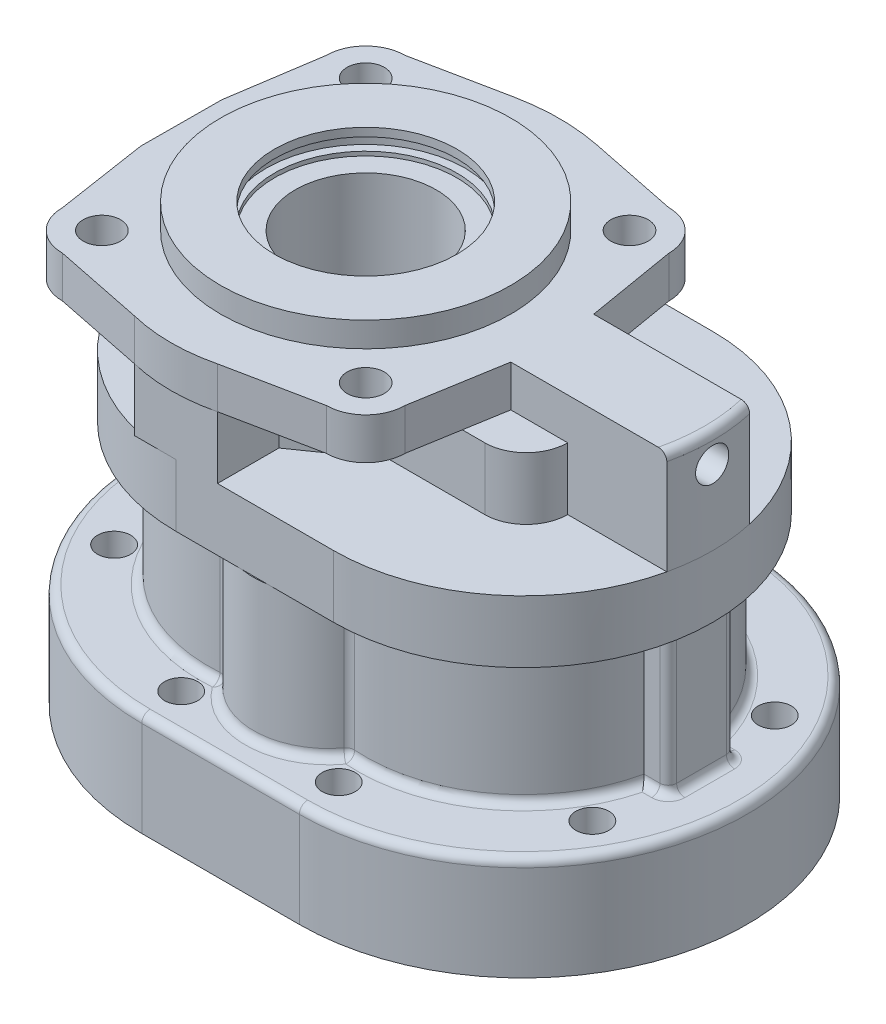
from build123d import *

# Parameters (mm, degrees)
EXTRUDE_2_DEPTH           = 25
SKETCH_4_R                = 4
CUT_EXTRUDE_2_DEPTH       = 105.559884938
EXTRUDE_5_DEPTH           = 34
SKETCH_7_W                = 15.238201221
SKETCH_7_H                = 16
EXTRUDE_6_DEPTH           = 34
EXTRUDE_8_DEPTH           = 15
EXTRUDE_12_DEPTH          = 15
EXTRUDE_14_DEPTH          = 10
EXTRUDE_15_DEPTH          = 25
FILLET_12_R               = 10
FILLET_13_R               = 10
SKETCH_13_R               = 22
CUT_EXTRUDE_5_DEPTH       = 68
SKETCH_14_R               = 11.5
CUT_EXTRUDE_6_DEPTH       = 10
SKETCH_15_R               = 22
CUT_EXTRUDE_7_DEPTH       = 68
SKETCH_16_R               = 16
CUT_EXTRUDE_8_DEPTH       = 4
SKETCH_17_R               = 14
CUT_EXTRUDE_9_DEPTH       = 125.465937261
SKETCH_18_R               = 35
SKETCH_18_R_2             = 22
EXTRUDE_17_DEPTH          = 6
SKETCH_19_R               = 17
CUT_EXTRUDE_11_DEPTH      = 24
SKETCH_20_R               = 4.5
CUT_EXTRUDE_12_DEPTH      = 20
FILLET_14_R               = 2
CUT_EXTRUDE_13_DEPTH      = 147.057418635
CUT_EXTRUDE_13_DEPTH_BACK = 10
SKETCH_23_R               = 4
SKETCH_24_R               = 1
CUT_EXTRUDE_14_DEPTH      = 25
SKETCH_21_W               = 2.636226743
SKETCH_21_H               = 3
SKETCH_25_R               = 9
CUT_EXTRUDE_15_DEPTH      = 55
SKETCH_26_R               = 5.5
CUT_EXTRUDE_16_DEPTH      = 67
SKETCH_27_W               = 24.259371359
SKETCH_27_H               = 18.356421352
FILLET_2_R                = 2
FILLET_3_R                = 2
FILLET_4_R                = 2
EXTRUDE_7_DEPTH           = 15


with BuildPart() as part:
    # Эскиз2 → Вытянуть2 (new body)
    with BuildSketch(Plane(origin=(0, 0, 0), x_dir=(1, 0, 0), z_dir=(0, 1, 0))):
        with BuildLine():
            Line((6.024599226, 54), (-31.975400774, 54))
            ThreePointArc((-31.975400774, 54), (-85.975400774, 0), (-31.975400774, -54))
            Line((-31.975400774, -54), (6.024599226, -54))
            ThreePointArc((6.024599226, -54), (60.024599226, 0), (6.024599226, 54))
        make_face()
    extrude(amount=EXTRUDE_2_DEPTH)

    # Эскиз4 → Вырез-Вытянуть2 (cut, through all)
    with BuildSketch(Plane(origin=(0, 25, 0), x_dir=(1, 0, 0), z_dir=(0, 1, 0))):
        with Locations(Location((44.705990101, 22, 0), (0, 0, 270))):
            Circle(SKETCH_4_R)
        with Locations(Location((44.705990101, -22, 0), (0, 0, 270))):
            Circle(SKETCH_4_R)
        with Locations(Location((-70.656791649, -22, 0), (0, 0, 270))):
            Circle(SKETCH_4_R)
        with Locations(Location((-70.656791649, 22, 0), (0, 0, 270))):
            Circle(SKETCH_4_R)
        with Locations(Location((-31.975400774, -44.5, 0), (0, 0, 270))):
            Circle(SKETCH_4_R)
        with Locations(Location((6.024599226, -44.5, 0), (0, 0, 270))):
            Circle(SKETCH_4_R)
        with Locations(Location((6.024599226, 44.5, 0), (0, 0, 270))):
            Circle(SKETCH_4_R)
        with Locations(Location((-31.975400774, 44.5, 0), (0, 0, 270))):
            Circle(SKETCH_4_R)
    extrude(amount=-CUT_EXTRUDE_2_DEPTH, mode=Mode.SUBTRACT)

    # Эскиз5 → Вытянуть5 (add)
    with BuildSketch(Plane(origin=(0, 25, 0), x_dir=(1, 0, 0), z_dir=(0, 1, 0))):
        with BuildLine():
            ThreePointArc((-28.088058492, 37.800642455), (-69.975400774, 0), (-28.088058492, -37.800642455))
            ThreePointArc((-28.088058492, -37.800642455), (-12.975400774, -46.022729758), (2.137256944, -37.800642455))
            ThreePointArc((2.137256944, -37.800642455), (44.024599226, 0), (2.137256944, 37.800642455))
            ThreePointArc((2.137256944, 37.800642455), (-12.975400774, 46.022729758), (-28.088058492, 37.800642455))
        make_face()
    extrude(amount=EXTRUDE_5_DEPTH)

    # Эскиз7 → Вытянуть6 (add)
    with BuildSketch(Plane(origin=(0, 25, 0), x_dir=(1, 0, 0), z_dir=(0, 1, 0))):
        with Locations((41.405498616, 0)):
            Rectangle(SKETCH_7_W, SKETCH_7_H)
        with Locations((-67.356300164, 0)):
            Rectangle(SKETCH_7_W, SKETCH_7_H)
    extrude(amount=EXTRUDE_6_DEPTH)

    # Эскиз9 → Вытянуть8 (add)
    with BuildSketch(Plane(origin=(0, 59, 0), x_dir=(1, 0, 0), z_dir=(0, 1, 0))):
        with BuildLine():
            Line((6.024599226, 45.75), (-31.975400774, 45.75))
            ThreePointArc((-31.975400774, 45.75), (-77.725400774, 0), (-31.975400774, -45.75))
            Line((-31.975400774, -45.75), (6.024599226, -45.75))
            ThreePointArc((6.024599226, -45.75), (51.774599226, 0), (6.024599226, 45.75))
        make_face()
    extrude(amount=EXTRUDE_8_DEPTH)

    # Эскиз10 → Вытянуть12 (add)
    with BuildSketch(Plane(origin=(0, 74, 0), x_dir=(1, 0, 0), z_dir=(0, 1, 0))):
        with BuildLine():
            Line((-21.975400774, 45.75), (-41.975400774, 45.75))
            Line((-41.975400774, 45.75), (-41.975400774, 30.923292192))
            ThreePointArc((-41.975400774, 30.923292192), (-54.956371162, 22.980970389), (-62.898692966, 10))
            Line((-62.898692966, 10), (-76.619129337, 10))
            Line((-76.619129337, 10), (-76.619129337, -10))
            Line((-76.619129337, -10), (-62.898692966, -10))
            ThreePointArc((-62.898692966, -10), (-54.956371162, -22.980970389), (-41.975400774, -30.923292192))
            Line((-41.975400774, -30.923292192), (-41.975400774, -45.75))
            Line((-41.975400774, -45.75), (-21.975400774, -45.75))
            Line((-21.975400774, -45.75), (-21.975400774, -30.923292192))
            Line((-21.975400774, -30.923292192), (-6.358023859, -20))
            Line((-6.358023859, -20), (26.755646511, -20))
            Line((26.755646511, -20), (26.755646511, 20))
            Line((26.755646511, 20), (-6.358023859, 20))
            Line((-6.358023859, 20), (-21.975400774, 30.923292192))
            Line((-21.975400774, 30.923292192), (-21.975400774, 45.75))
        make_face()
    extrude(amount=EXTRUDE_12_DEPTH)

    # Эскиз11 → Вытянуть14 (add)
    with BuildSketch(Plane(origin=(0, 89, 0), x_dir=(1, 0, 0), z_dir=(0, 1, 0))):
        with BuildLine():
            Line((13.024599226, -10), (13.024599226, 10))
            Line((13.024599226, 10), (9.344404379, 31.819805153))
            ThreePointArc((9.344404379, 31.819805153), (6.561918801, 38.537319575), (-0.155595621, 41.319805153))
            Line((-0.155595621, 41.319805153), (-21.975400774, 45.75))
            ThreePointArc((-21.975400774, 45.75), (-31.975400774, 46.754925429), (-41.975400774, 45.75))
            Line((-41.975400774, 45.75), (-63.795205927, 41.319805153))
            ThreePointArc((-63.795205927, 41.319805153), (-70.512720349, 38.537319575), (-73.295205927, 31.819805153))
            Line((-73.295205927, 31.819805153), (-76.619129337, 10))
            Line((-76.619129337, 10), (-76.719278013, -9.541904925))
            Line((-76.719278013, -9.541904925), (-73.295205927, -31.819805153))
            ThreePointArc((-73.295205927, -31.819805153), (-70.512720349, -38.537319575), (-63.795205927, -41.319805153))
            Line((-63.795205927, -41.319805153), (-41.975400774, -45.75))
            ThreePointArc((-41.975400774, -45.75), (-31.975400774, -46.953210913), (-21.975400774, -45.75))
            Line((-21.975400774, -45.75), (-0.155595621, -41.319805153))
            ThreePointArc((-0.155595621, -41.319805153), (6.561918801, -38.537319575), (9.344404379, -31.819805153))
            Line((9.344404379, -31.819805153), (13.024599226, -10))
        make_face()
    extrude(amount=EXTRUDE_14_DEPTH)

    # Эскиз12 → Вытянуть15 (add)
    with BuildSketch(Plane(origin=(0, 74, 0), x_dir=(1, 0, 0), z_dir=(0, 1, 0))):
        with BuildLine():
            Line((50.668327789, 10), (13.024599226, 10))
            Line((13.024599226, 10), (13.024599226, -10))
            Line((13.024599226, -10), (50.668327789, -10))
            ThreePointArc((50.668327789, -10), (51.783107556, 0), (50.668327789, 10))
        make_face()
    extrude(amount=EXTRUDE_15_DEPTH)

    # Скругление12
    fillet_12_edges = [part.edges().sort_by_distance(p)[0] for p in [
        (26.755646511, 81.5, 20),
    ]]
    fillet(fillet_12_edges, radius=FILLET_12_R - 0.0001)  # a hair under: the kernel refuses the full size

    # Скругление13
    fillet_13_edges = [part.edges().sort_by_distance(p)[0] for p in [
        (26.755646511, 81.5, -20),
    ]]
    fillet(fillet_13_edges, radius=FILLET_13_R - 0.0001)  # a hair under: the kernel refuses the full size

    # Эскиз13 → Вырез-Вытянуть5 (cut)
    with BuildSketch(Plane.XZ):
        with Locations(Location((6.024599226, 0, 0), (0, 0, 270))):
            Circle(SKETCH_13_R)
    extrude(amount=-CUT_EXTRUDE_5_DEPTH, mode=Mode.SUBTRACT)

    # Эскиз14 → Вырез-Вытянуть6 (cut)
    with BuildSketch(Plane.XZ.offset(-68)):
        with Locations(Location((6.024599226, 0, 0), (0, 0, 270))):
            Circle(SKETCH_14_R)
    extrude(amount=-CUT_EXTRUDE_6_DEPTH, mode=Mode.SUBTRACT)

    # Эскиз15 → Вырез-Вытянуть7 (cut)
    with BuildSketch(Plane.XZ):
        with Locations((-31.975400774, 0)):
            Circle(SKETCH_15_R)
    extrude(amount=-CUT_EXTRUDE_7_DEPTH, mode=Mode.SUBTRACT)

    # Эскиз16 → Вырез-Вытянуть8 (cut)
    with BuildSketch(Plane.XZ.offset(-68)):
        with Locations(Location((-31.975400774, 0, 0), (0, 0, 270))):
            Circle(SKETCH_16_R)
    extrude(amount=-CUT_EXTRUDE_8_DEPTH, mode=Mode.SUBTRACT)

    # Эскиз17 → Вырез-Вытянуть9 (cut, through all)
    with BuildSketch(Plane.XZ.offset(-72)):
        with Locations(Location((-31.975400774, 0, 0), (0, 0, 270))):
            Circle(SKETCH_17_R)
    extrude(amount=-CUT_EXTRUDE_9_DEPTH, mode=Mode.SUBTRACT)

    # Эскиз18 → Вытянуть17 (add)
    with BuildSketch(Plane(origin=(0, 99, 0), x_dir=(1, 0, 0), z_dir=(0, 1, 0))):
        with Locations(Location((-31.975400774, 0, 0), (0, 0, 270))):
            Circle(SKETCH_18_R)
        with Locations(Location((-31.975400774, 0, 0), (0, 0, 270))):
            Circle(SKETCH_18_R_2, mode=Mode.SUBTRACT)
    extrude(amount=EXTRUDE_17_DEPTH)

    # Эскиз19 → Вырез-Вытянуть11 (cut)
    with BuildSketch(Plane(origin=(0, 99, 0), x_dir=(1, 0, 0), z_dir=(0, 1, 0))):
        with Locations(Location((-31.975400774, 0, 0), (0, 0, 270))):
            Circle(SKETCH_19_R)
    extrude(amount=-CUT_EXTRUDE_11_DEPTH, mode=Mode.SUBTRACT)

    # Эскиз20 → Вырез-Вытянуть12 (cut)
    with BuildSketch(Plane(origin=(0, 99, 0), x_dir=(1, 0, 0), z_dir=(0, 1, 0))):
        with Locations(Location((-63.795205927, 31.819805153, 0), (0, 0, 270))):
            Circle(SKETCH_20_R)
        with Locations(Location((-63.795205927, -31.819805153, 0), (0, 0, 270))):
            Circle(SKETCH_20_R)
        with Locations(Location((-0.155595621, -31.819805153, 0), (0, 0, 270))):
            Circle(SKETCH_20_R)
        with Locations(Location((-0.155595621, 31.819805153, 0), (0, 0, 270))):
            Circle(SKETCH_20_R)
    extrude(amount=-CUT_EXTRUDE_12_DEPTH, mode=Mode.SUBTRACT)

    # Скругление14
    fillet_14_edges = [part.edges().sort_by_distance(p)[0] for p in [
        (51.783107556, 99, 0),
    ]]
    fillet(fillet_14_edges, radius=FILLET_14_R)

    # Эскиз23 → Вырез-Вытянуть13 (cut, two sides: drawn at the far end of the back side and taken through both)
    with BuildSketch(Plane(origin=(0, 0, 0), x_dir=(0, 0, -1), z_dir=(1, 0, 0)).offset(-CUT_EXTRUDE_13_DEPTH_BACK)):
        with Locations(Location((0, 92, 0), (0, 0, 180))):
            Circle(SKETCH_23_R)
    extrude(amount=CUT_EXTRUDE_13_DEPTH + CUT_EXTRUDE_13_DEPTH_BACK, mode=Mode.SUBTRACT)

    # Эскиз24 → Вырез-Вытянуть14 (cut)
    with BuildSketch(Plane(origin=(0, 0, 0), x_dir=(0, 0, -1), z_dir=(1, 0, 0))):
        with Locations((0, 92)):
            Circle(SKETCH_24_R)
    extrude(amount=-CUT_EXTRUDE_14_DEPTH, mode=Mode.SUBTRACT)

    # Эскиз21 → Вырез-Повернуть2 (revolve, cut)
    with BuildSketch(Plane.XY, mode=Mode.PRIVATE) as cut_revolve_2_sk:
        with Locations((-9.293514146, 101.5)):
            Rectangle(SKETCH_21_W, SKETCH_21_H)
    revolve(cut_revolve_2_sk.sketch.rotate(Axis((-31.975400774, 125.443273982, 0), (0, -1, 0)), 90), axis=Axis((-31.975400774, 125.443273982, 0), (0, -1, 0)), mode=Mode.SUBTRACT)

    # Эскиз25 → Вырез-Вытянуть15 (cut)
    with BuildSketch(Plane.XZ):
        with Locations(Location((-12.975400774, 28, 0), (0, 0, 270))):
            Circle(SKETCH_25_R)
    extrude(amount=-CUT_EXTRUDE_15_DEPTH, mode=Mode.SUBTRACT)

    # Эскиз26 → Вырез-Вытянуть16 (cut)
    with BuildSketch(Plane.XZ):
        with Locations(Location((-12.975400774, -26.5, 0), (0, 0, 270))):
            Circle(SKETCH_26_R)
    extrude(amount=-CUT_EXTRUDE_16_DEPTH, mode=Mode.SUBTRACT)

    # Вырез-По траектории1: sweep along a path in Эскиз28
    with BuildLine(Plane.XZ) as sweep_1_path:
        CenterArc((-12.920623252, 0), 32.286860088, 0, 360)
    # Эскиз27 → Вырез-По траектории1 (sweep, cut)
    with BuildSketch(Plane.XY):
        with Locations((2.702965141, 32.074328736)):
            Rectangle(SKETCH_27_W, SKETCH_27_H)
    sweep(path=sweep_1_path.line, mode=Mode.SUBTRACT)

    # Скругление2
    fillet_2_edges = [part.edges().sort_by_distance(p)[0] for p in [
        (49.024599226, 42, -8),
        (49.024599226, 42, 8),
    ]]
    fillet(fillet_2_edges, radius=FILLET_2_R)

    # Скругление3
    fillet_3_edges = [part.edges().sort_by_distance(p)[0] for p in [
        (45.098774847, 25, 8),
        (48.438812788, 25, 7.414213562),
        (49.024599226, 25, 0),
        (48.438812788, 25, -7.414213562),
        (45.098774847, 25, -8),
        (-54.304602549, 25, -30.747467344),
        (-12.975400774, 25, -46.022729758),
        (28.353801002, 25, -30.747467344),
        (28.353801002, 25, 30.747467344),
        (-54.304602549, 25, 30.747467344),
        (-12.975400774, 25, 46.022729758),
        (2.137256944, 42, 37.800642455),
        (-28.088058492, 42, 37.800642455),
        (-28.088058492, 42, -37.800642455),
        (2.137256944, 42, -37.800642455),
    ]]
    fillet(fillet_3_edges, radius=FILLET_3_R)

    # Скругление4
    fillet_4_edges = [part.edges().sort_by_distance(p)[0] for p in [
        (-85.975400774, 25, 0),
        (-12.975400774, 25, 54),
        (60.024599226, 25, 0),
        (-12.975400774, 25, -54),
    ]]
    fillet(fillet_4_edges, radius=FILLET_4_R)

    # Эскиз8 → Вытянуть7 (add)
    with BuildSketch(Plane(origin=(0, 59, 0), x_dir=(1, 0, 0), z_dir=(0, 1, 0))):
        with BuildLine():
            Line((6.024599226, 45.5), (-31.975400774, 45.5))
            ThreePointArc((-31.975400774, 45.5), (-77.475400774, 0), (-31.975400774, -45.5))
            Line((-31.975400774, -45.5), (6.024599226, -45.5))
            ThreePointArc((6.024599226, -45.5), (51.524599226, 0), (6.024599226, 45.5))
        make_face()
    extrude(amount=EXTRUDE_7_DEPTH)


solid = part.part
